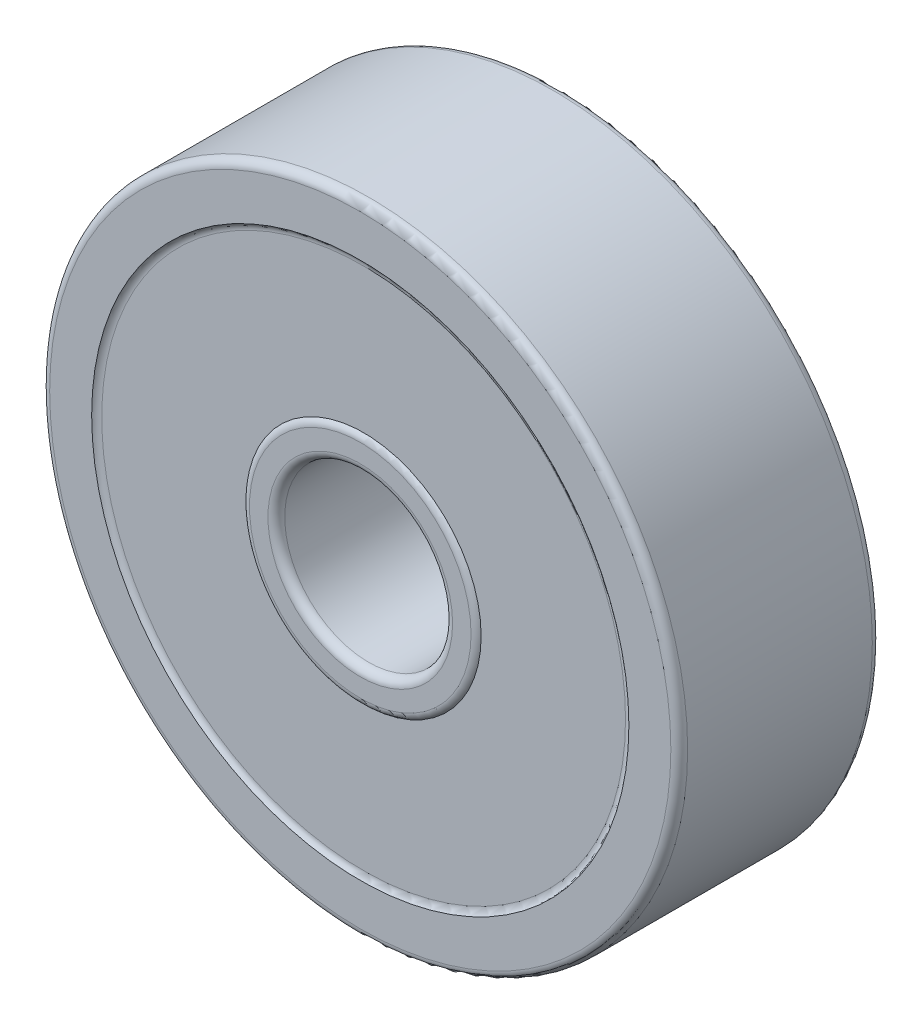
from build123d import *

# Parameters (mm, degrees)
BOSS_EXTRU_1_DEPTH           = 3
BOSS_EXTRU_1_DEPTH_BACK      = 3
ESQUISSE1_R                  = 9.5
ESQUISSE1_R_2                = 2.5
ENL_V_MAT_EXTRU_1_DEPTH      = 6
ENL_V_MAT_EXTRU_1_DEPTH_BACK = 6
ESQUISSE2_R                  = 8
ESQUISSE2_R_2                = 3.5
BOSS_EXTRU_2_DEPTH           = 2.9
BOSS_EXTRU_2_DEPTH_BACK      = 2.9
ESQUISSE4_R                  = 8
ESQUISSE4_R_2                = 3.5
CONG_1_R                     = 0.25


with BuildPart() as part:
    # Esquisse1 → Boss.-Extru.1 (new, two sides: drawn at the far end of the back side and taken through both)
    with BuildSketch(Plane.XY.offset(-BOSS_EXTRU_1_DEPTH_BACK)):
        Circle(ESQUISSE1_R)
        Circle(ESQUISSE1_R_2, mode=Mode.SUBTRACT)
    extrude(amount=BOSS_EXTRU_1_DEPTH + BOSS_EXTRU_1_DEPTH_BACK)

    # Esquisse2 → Enlèv. mat.-Extru.1 (cut, two sides: drawn at the far end of the back side and taken through both)
    with BuildSketch(Plane.XY.offset(-ENL_V_MAT_EXTRU_1_DEPTH_BACK)):
        Circle(ESQUISSE2_R)
        Circle(ESQUISSE2_R_2, mode=Mode.SUBTRACT)
    extrude(amount=ENL_V_MAT_EXTRU_1_DEPTH + ENL_V_MAT_EXTRU_1_DEPTH_BACK, mode=Mode.SUBTRACT)


with BuildPart() as enl_v_mat_extru_1_piece_1:
    # of the separate pieces the step leaves, piece 1, a body of its own (enl_v_mat_extru_1_pieces)
    add(part.part.solids().sort_by_distance((9.5, 0, 0))[0])



with BuildPart() as enl_v_mat_extru_1_piece_2:
    # of the separate pieces the step leaves, piece 2, a body of its own (enl_v_mat_extru_1_pieces)
    add(part.part.solids().sort_by_distance((3.5, 0, 3))[0])


with BuildPart() as enl_v_mat_extru_1_piece_1_1:
    add(enl_v_mat_extru_1_piece_1.part)

    add(enl_v_mat_extru_1_piece_2.part)  # Boss.-Extru.2 merges Enlèv. mat.-Extru.1 piece 2
    # Esquisse4 → Boss.-Extru.2 (add, two sides: drawn at the far end of the back side and taken through both)
    with BuildSketch(Plane.XY.offset(-BOSS_EXTRU_2_DEPTH_BACK)):
        Circle(ESQUISSE4_R)
        Circle(ESQUISSE4_R_2, mode=Mode.SUBTRACT)
    extrude(amount=BOSS_EXTRU_2_DEPTH + BOSS_EXTRU_2_DEPTH_BACK)

    # Congé1
    # the kernel refuses this fillet: 0.25 mm, written as the material it adds along each edge
    with BuildSketch(Plane(origin=(0, 0, 2.9), x_dir=(1, 0, 0), z_dir=(0, -1, 0))) as cong_1_piece_1:
        with BuildLine():
            CenterArc((7.8, 0.25), CONG_1_R, 270, 53.130102355)
            Line((8, 0.1), (8.004, 0.097))
            ThreePointArc((8.004, 0.097), (8.005, 0.05), (8.005, 0))
            Line((8.005, 0), (8, -0.005))
            Line((8, -0.005), (7.8, -0.005))
            Line((7.8, -0.005), (7.8, 0))
        make_face()
    revolve(axis=Axis((0, 0, 2.9), (0, 0, 1)))
    # the kernel refuses this fillet: 0.25 mm, written as the material it takes off along each edge
    with BuildSketch(Plane(origin=(0, 0, -3), x_dir=(1, 0, 0), z_dir=(0, -1, 0))) as cong_1_2_piece_1:
        with BuildLine():
            CenterArc((2.5 + CONG_1_R, CONG_1_R), CONG_1_R, 180, 90)
            Line((2.5 + CONG_1_R, 0), (2.5 + CONG_1_R, -CONG_1_R * 0.02))
            Line((2.5 + CONG_1_R, -CONG_1_R * 0.02), (2.5 - CONG_1_R * 0.02, -CONG_1_R * 0.02))
            Line((2.5 - CONG_1_R * 0.02, -CONG_1_R * 0.02), (2.5 - CONG_1_R * 0.02, CONG_1_R))
            Line((2.5 - CONG_1_R * 0.02, CONG_1_R), (2.5, CONG_1_R))
        make_face()
    revolve(axis=Axis((0, 0, -3), (0, 0, 1)), mode=Mode.SUBTRACT)
    with BuildSketch(Plane(origin=(0, 0, 3), x_dir=(1, 0, 0), z_dir=(0, -1, 0))) as cong_1_2_piece_2:
        with BuildLine():
            CenterArc((9.5 - CONG_1_R, -CONG_1_R), CONG_1_R, 0, 90)
            Line((9.5, -CONG_1_R), (9.5 + CONG_1_R * 0.02, -CONG_1_R))
            Line((9.5 + CONG_1_R * 0.02, -CONG_1_R), (9.5 + CONG_1_R * 0.02, CONG_1_R * 0.02))
            Line((9.5 + CONG_1_R * 0.02, CONG_1_R * 0.02), (9.5 - CONG_1_R, CONG_1_R * 0.02))
            Line((9.5 - CONG_1_R, CONG_1_R * 0.02), (9.5 - CONG_1_R, 0))
        make_face()
    revolve(axis=Axis((0, 0, 3), (0, 0, 1)), mode=Mode.SUBTRACT)
    with BuildSketch(Plane(origin=(0, 0, -3), x_dir=(1, 0, 0), z_dir=(0, -1, 0))) as cong_1_2_piece_3:
        with BuildLine():
            CenterArc((3.3, 0.25), CONG_1_R, 270, 53.130102355)
            Line((3.5, 0.1), (3.504, 0.097))
            ThreePointArc((3.504, 0.097), (3.505, 0.05), (3.505, 0))
            Line((3.505, 0), (3.5, -0.005))
            Line((3.5, -0.005), (3.3, -0.005))
            Line((3.3, -0.005), (3.3, 0))
        make_face()
    revolve(axis=Axis((0, 0, -3), (0, 0, 1)), mode=Mode.SUBTRACT)
    with BuildSketch(Plane(origin=(0, 0, 3), x_dir=(1, 0, 0), z_dir=(0, -1, 0))) as cong_1_2_piece_4:
        with BuildLine():
            CenterArc((2.5 + CONG_1_R, -CONG_1_R), CONG_1_R, 90, 90)
            Line((2.5, -CONG_1_R), (2.5 - CONG_1_R * 0.02, -CONG_1_R))
            Line((2.5 - CONG_1_R * 0.02, -CONG_1_R), (2.5 - CONG_1_R * 0.02, CONG_1_R * 0.02))
            Line((2.5 - CONG_1_R * 0.02, CONG_1_R * 0.02), (2.5 + CONG_1_R, CONG_1_R * 0.02))
            Line((2.5 + CONG_1_R, CONG_1_R * 0.02), (2.5 + CONG_1_R, 0))
        make_face()
    revolve(axis=Axis((0, 0, 3), (0, 0, 1)), mode=Mode.SUBTRACT)
    with BuildSketch(Plane(origin=(0, 0, 3), x_dir=(1, 0, 0), z_dir=(0, 1, 0))) as cong_1_2_piece_5:
        with BuildLine():
            CenterArc((3.3, 0.25), CONG_1_R, 270, 53.130102355)
            Line((3.5, 0.1), (3.504, 0.097))
            ThreePointArc((3.504, 0.097), (3.505, 0.05), (3.505, 0))
            Line((3.505, 0), (3.5, -0.005))
            Line((3.5, -0.005), (3.3, -0.005))
            Line((3.3, -0.005), (3.3, 0))
        make_face()
    revolve(axis=Axis((0, 0, 3), (0, 0, -1)), mode=Mode.SUBTRACT)
    with BuildSketch(Plane(origin=(0, 0, -3), x_dir=(1, 0, 0), z_dir=(0, -1, 0))) as cong_1_2_piece_6:
        with BuildLine():
            CenterArc((8.2, 0.25), CONG_1_R, 216.869897645, 53.130102355)
            Line((8.2, 0), (8.2, -0.005))
            Line((8.2, -0.005), (8, -0.005))
            Line((8, -0.005), (7.995, 0))
            ThreePointArc((7.995, 0), (7.995, 0.05), (7.996, 0.097))
            Line((7.996, 0.097), (8, 0.1))
        make_face()
    revolve(axis=Axis((0, 0, -3), (0, 0, 1)), mode=Mode.SUBTRACT)
    with BuildSketch(Plane(origin=(0, 0, -3), x_dir=(1, 0, 0), z_dir=(0, -1, 0))) as cong_1_2_piece_7:
        with BuildLine():
            CenterArc((9.5 - CONG_1_R, CONG_1_R), CONG_1_R, 270, 90)
            Line((9.5 - CONG_1_R, 0), (9.5 - CONG_1_R, -CONG_1_R * 0.02))
            Line((9.5 - CONG_1_R, -CONG_1_R * 0.02), (9.5 + CONG_1_R * 0.02, -CONG_1_R * 0.02))
            Line((9.5 + CONG_1_R * 0.02, -CONG_1_R * 0.02), (9.5 + CONG_1_R * 0.02, CONG_1_R))
            Line((9.5 + CONG_1_R * 0.02, CONG_1_R), (9.5, CONG_1_R))
        make_face()
    revolve(axis=Axis((0, 0, -3), (0, 0, 1)), mode=Mode.SUBTRACT)


solid = enl_v_mat_extru_1_piece_1_1.part
